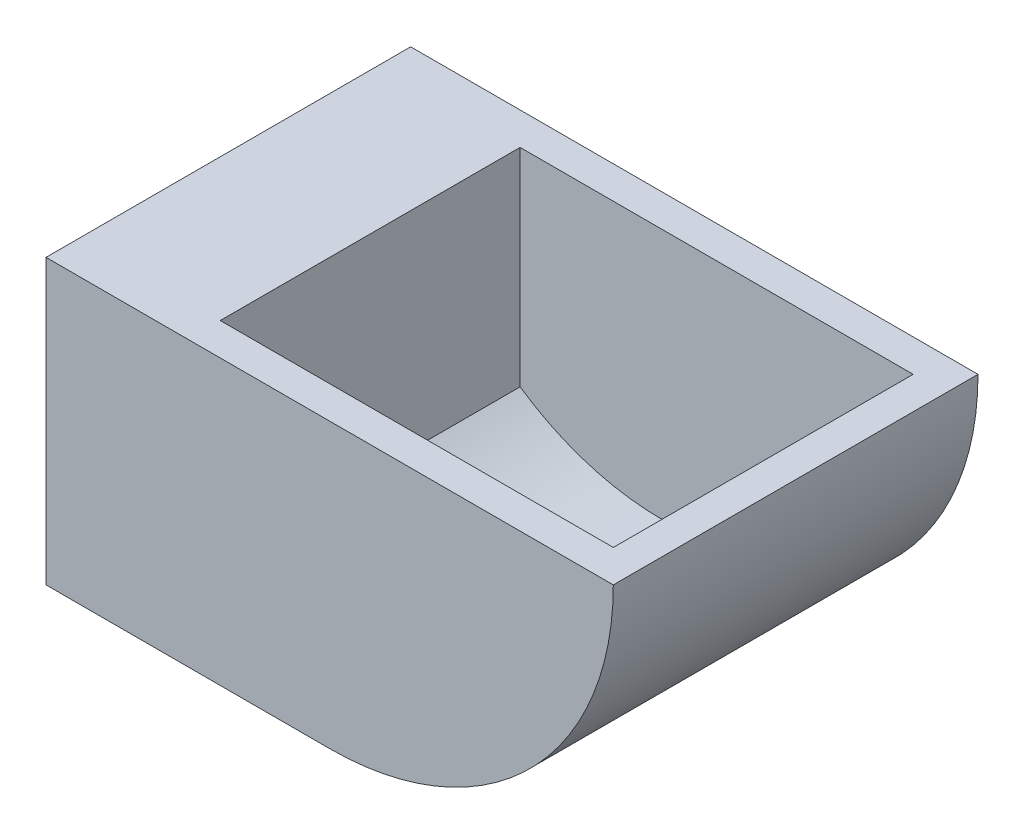
from build123d import *

# Parameters (mm, degrees)
BOSS_EXTRUDE1_DEPTH = 45
SKETCH2_W           = 31
SKETCH2_H           = 37
BOSS_EXTRUDE3_START = -45
BOSS_EXTRUDE3_DEPTH = 45


with BuildPart() as part:
    # Sketch1 → Boss-Extrude1 (new body)
    with BuildSketch(Plane.XY):
        with BuildLine():
            Line((35, 0), (-35, 0))
            ThreePointArc((-35, 0), (0, -35), (35, 0))
        make_face()
    extrude(amount=BOSS_EXTRUDE1_DEPTH)

    # Sketch2 → Cut-Revolve1 (revolve, cut)
    with BuildSketch(Plane(origin=(0, 0, 0), x_dir=(1, 0, 0), z_dir=(0, 1, 0))):
        with Locations((-15.5, -22.5)):
            Rectangle(SKETCH2_W, SKETCH2_H)
    revolve(axis=Axis((0, 0, 0), (0, 0, 1)), mode=Mode.SUBTRACT)

    # Sketch3 → Boss-Extrude3 (add)
    with BuildSketch(Plane.XY.offset(45).offset(BOSS_EXTRUDE3_START)):
        with BuildLine():
            Line((-17.5, -30.310889132), (-17.5, 0))
            Line((-17.5, 0), (-35, 0))
            Line((-35, 0), (-35, -35))
            Line((-35, -35), (0, -35))
            ThreePointArc((0, -35), (-9.058666579, -33.80740392), (-17.5, -30.310889132))
        make_face()
    extrude(amount=BOSS_EXTRUDE3_DEPTH)


solid = part.part
